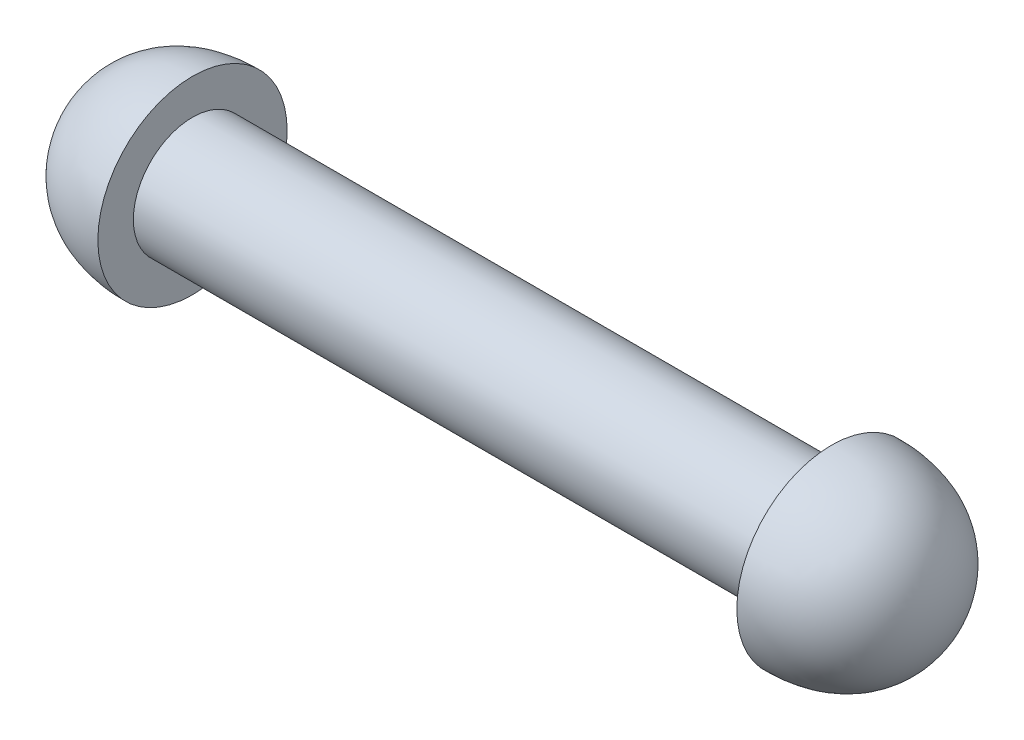
from build123d import *

# Parameters (mm, degrees)
SKETCH1_R           = 25
BOSS_EXTRUDE1_DEPTH = 135


with BuildPart() as part:
    # Sketch1 → Boss-Extrude1 (new body)
    with BuildSketch(Plane(origin=(0, 0, 0), x_dir=(0, 0, -1), z_dir=(1, 0, 0))):
        Circle(SKETCH1_R)
    boss_extrude1 = extrude(amount=BOSS_EXTRUDE1_DEPTH)

    # Sketch3 → Revolve1 (revolve)
    with BuildSketch(Plane.XY):
        with BuildLine():
            Line((0, 0), (-45.458392513, 0))
            add(Edge.make_bspline(
                [(-45.458392513, 0), (-45.458392513, 20.183781855), (-30.991238831, 40), (0, 40)],
                knots=[0, 0, 0, 0, 1, 1, 1, 1], degree=3))
            Line((0, 40), (0, 0))
        make_face()
    revolve1 = revolve(axis=Axis((-100.078673334, 0, 0), (1, 0, 0)))

    # Mirror1: Boss-Extrude1, Revolve1 across plane
    add(boss_extrude1.mirror(Plane(origin=(135, 0, 0), x_dir=(0, 0, 1), z_dir=(1, 0, 0))))
    add(revolve1.mirror(Plane(origin=(135, 0, 0), x_dir=(0, 0, 1), z_dir=(1, 0, 0))))


solid = part.part
